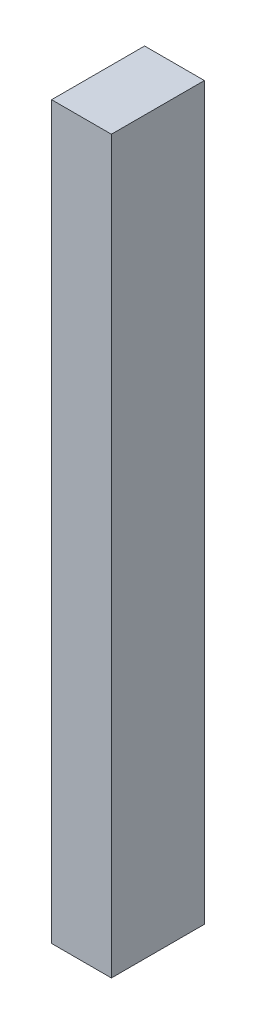
from build123d import *

# Parameters (mm, degrees)
CROQUIS1_W              = 6.3
CROQUIS1_H              = 9.8
SALIENTE_EXTRUIR1_DEPTH = 77


with BuildPart() as part:
    # Croquis1 → Saliente-Extruir1 (new body)
    with BuildSketch(Plane(origin=(0, 0, 0), x_dir=(1, 0, 0), z_dir=(0, 1, 0))):
        Rectangle(CROQUIS1_W, CROQUIS1_H)
    extrude(amount=SALIENTE_EXTRUIR1_DEPTH)


solid = part.part
